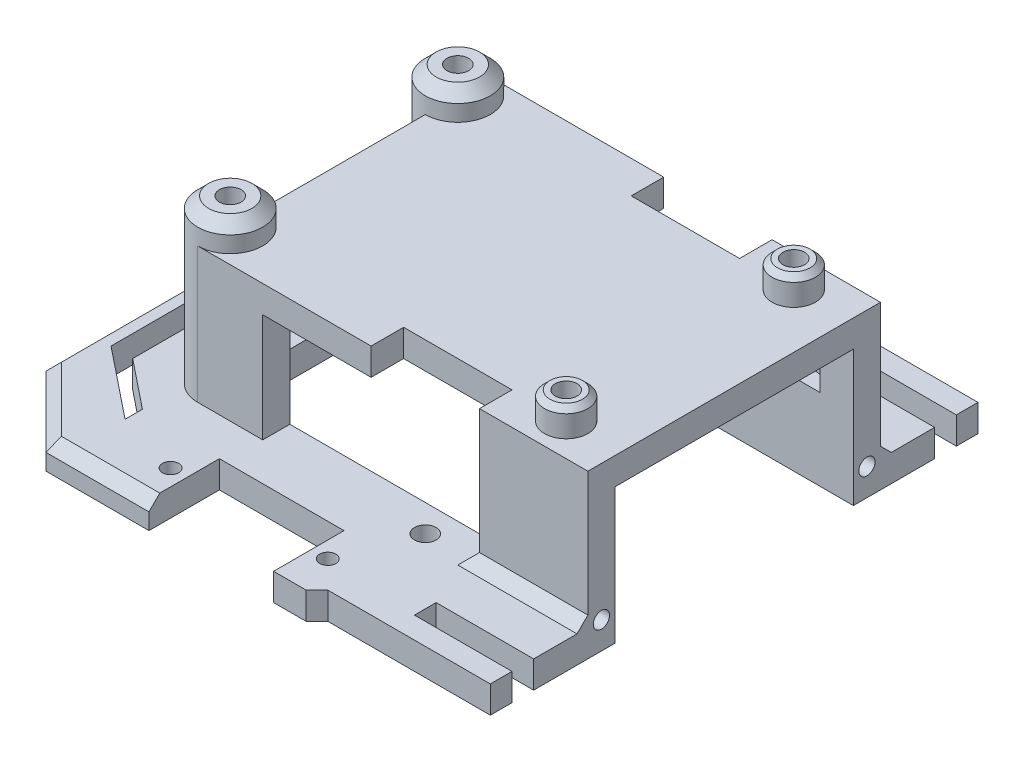
from build123d import *

# Parameters (mm, degrees)
SKETCH1_R           = 2
SKETCH1_R_2         = 1.5
BOSS_EXTRUDE1_DEPTH = 5
SKETCH2_W           = 4
SKETCH2_H           = 16
CUT_EXTRUDE1_DEPTH  = 5
BOSS_EXTRUDE3_DEPTH = 25
SKETCH4_W           = 72
SKETCH4_H           = 54
BOSS_EXTRUDE4_DEPTH = 5
SKETCH5_W           = 40
SKETCH5_H           = 20
CUT_EXTRUDE2_DEPTH  = 123.576506721
SKETCH6_W           = 20
SKETCH6_H           = 6
CUT_EXTRUDE4_DEPTH  = 10
BOSS_EXTRUDE5_START = -5
SKETCH7_R           = 4
BOSS_EXTRUDE5_DEPTH = 5
SKETCH8_R           = 2
CUT_EXTRUDE5_DEPTH  = 10
CUT_EXTRUDE6_START  = 10
SKETCH9_R           = 4
CUT_EXTRUDE6_DEPTH  = 10
BOSS_EXTRUDE6_START = 5
SKETCH10_R          = 6
BOSS_EXTRUDE6_DEPTH = 30
SKETCH11_R          = 2
CUT_EXTRUDE7_DEPTH  = 10
CUT_EXTRUDE8_START  = 20
SKETCH12_R          = 4.5
CUT_EXTRUDE8_DEPTH  = 129.434311913
SKETCH14_R          = 4.5
CUT_EXTRUDE11_DEPTH = 108.158760724
SKETCH13_R          = 1.5
BOSS_EXTRUDE8_DEPTH = 3
CHAMFER2_SIZE       = 1
CHAMFER3_SIZE       = 2
CHAMFER4_SIZE       = 2
CHAMFER5_SIZE       = 2
CUT_EXTRUDE15_START = -3
SKETCH13_3_R        = 1.5
CUT_EXTRUDE15_DEPTH = 3
CUT_EXTRUDE18_START = 3
SKETCH13_5_R        = 1.5
CUT_EXTRUDE18_DEPTH = 6
SKETCH23_R          = 1.5
CUT_EXTRUDE19_DEPTH = 6


with BuildPart() as part:
    # Sketch1 → Boss-Extrude1 (new body)
    with BuildSketch(Plane(origin=(0, 0, 0), x_dir=(1, 0, 0), z_dir=(0, 1, 0))):
        Polygon((0, 34), (0, -34), (13, -47), (32, -47), (32, -34), (55, -34), (55, -47), (61, -47), (63, -45), (93, -45), (93, -41), (75, -41), (75, -37), (93, -37), (93, -22), (33, -22), (21, -10), (21, 10), (33, 22), (93, 22), (93, 37), (75, 37), (75, 41), (93, 41), (93, 45), (63, 45), (61, 47), (55, 47), (55, 34), (32, 34), (32, 47), (13, 47), align=None)
        with Locations(Location((13, -10, 0), (0, 0, 270))):
            Circle(SKETCH1_R, mode=Mode.SUBTRACT)
        with Locations(Location((29, -40, 0), (0, 0, 270))):
            Circle(SKETCH1_R_2, mode=Mode.SUBTRACT)
        with Locations(Location((58, -40, 0), (0, 0, 270))):
            Circle(SKETCH1_R_2, mode=Mode.SUBTRACT)
        with Locations(Location((63, -27, 0), (0, 0, 270))):
            Circle(SKETCH1_R, mode=Mode.SUBTRACT)
        with Locations(Location((13, 10, 0), (0, 0, 90))):
            Circle(SKETCH1_R, mode=Mode.SUBTRACT)
        with Locations(Location((29, 40, 0), (0, 0, 90))):
            Circle(SKETCH1_R_2, mode=Mode.SUBTRACT)
        with Locations(Location((58, 40, 0), (0, 0, 90))):
            Circle(SKETCH1_R_2, mode=Mode.SUBTRACT)
        with Locations(Location((63, 27, 0), (0, 0, 90))):
            Circle(SKETCH1_R, mode=Mode.SUBTRACT)
    extrude(amount=BOSS_EXTRUDE1_DEPTH)

    # Sketch2 → Cut-Extrude1 (cut)
    with BuildSketch(Plane(origin=(0, 5, 0), x_dir=(1, 0, 0), z_dir=(0, 1, 0))):
        Polygon((17, 33.205766921), (17, 36.408329997), (4, 26), (4, 12), (8, 12), (8, 26), align=None)
        with Locations((6, 0)):
            Rectangle(SKETCH2_W, SKETCH2_H)
        Polygon((17, -33.205766921), (17, -36.408329997), (4, -26), (4, -12), (8, -12), (8, -26), align=None)
    extrude(amount=-CUT_EXTRUDE1_DEPTH, mode=Mode.SUBTRACT)

    # Sketch3 → Boss-Extrude3 (add)
    with BuildSketch(Plane(origin=(0, 5, 0), x_dir=(1, 0, 0), z_dir=(0, 1, 0))):
        Polygon((21, 27), (21, 10), (33, 22), (93, 22), (93, 27), align=None)
        Polygon((93, -27), (93, -22), (33, -22), (21, -10), (21, -27), align=None)
    extrude(amount=BOSS_EXTRUDE3_DEPTH)

    # Sketch4 → Boss-Extrude4 (add)
    with BuildSketch(Plane(origin=(0, 30, 0), x_dir=(1, 0, 0), z_dir=(0, 1, 0))):
        with Locations((57, 0)):
            Rectangle(SKETCH4_W, SKETCH4_H)
    extrude(amount=-BOSS_EXTRUDE4_DEPTH)

    # Sketch5 → Cut-Extrude2 (cut, through all)
    with BuildSketch(Plane.XY.offset(27)):
        with Locations((53, 15)):
            Rectangle(SKETCH5_W, SKETCH5_H)
    extrude(amount=-CUT_EXTRUDE2_DEPTH, mode=Mode.SUBTRACT)

    # Sketch6 → Cut-Extrude4 (cut)
    with BuildSketch(Plane(origin=(0, 30, 0), x_dir=(1, 0, 0), z_dir=(0, 1, 0))):
        with Locations((63, 24)):
            Rectangle(SKETCH6_W, SKETCH6_H)
        with Locations((63, -24)):
            Rectangle(SKETCH6_W, SKETCH6_H)
    extrude(amount=-CUT_EXTRUDE4_DEPTH, mode=Mode.SUBTRACT)

    # Sketch7 → Boss-Extrude5 (add)
    with BuildSketch(Plane.XZ.offset(-25).offset(BOSS_EXTRUDE5_START)):
        with Locations(Location((83, 21, 0), (0, 0, 270))):
            Circle(SKETCH7_R)
        with Locations(Location((83, -21, 0), (0, 0, 270))):
            Circle(SKETCH7_R)
    extrude(amount=-BOSS_EXTRUDE5_DEPTH)

    # Sketch8 → Cut-Extrude5 (cut)
    with BuildSketch(Plane(origin=(0, 35, 0), x_dir=(1, 0, 0), z_dir=(0, 1, 0))):
        with Locations(Location((83, 21, 0), (0, 0, 270))):
            Circle(SKETCH8_R)
    cut_extrude5 = extrude(amount=-CUT_EXTRUDE5_DEPTH, mode=Mode.SUBTRACT)

    # Sketch9 → Cut-Extrude6 (cut)
    with BuildSketch(Plane.XZ.offset(-25).offset(CUT_EXTRUDE6_START)):
        with Locations(Location((83, -21, 0), (0, 0, 270))):
            Circle(SKETCH9_R)
    cut_extrude6 = extrude(amount=-CUT_EXTRUDE6_DEPTH, mode=Mode.SUBTRACT)

    # Sketch10 → Boss-Extrude6 (add)
    with BuildSketch(Plane(origin=(0, 30, 0), x_dir=(1, 0, 0), z_dir=(0, 1, 0)).offset(BOSS_EXTRUDE6_START)):
        with Locations(Location((21, 21, 0), (0, 0, 270))):
            Circle(SKETCH10_R)
    boss_extrude6 = extrude(amount=-BOSS_EXTRUDE6_DEPTH)

    # Sketch11 → Cut-Extrude7 (cut)
    with BuildSketch(Plane(origin=(0, 35, 0), x_dir=(1, 0, 0), z_dir=(0, 1, 0))):
        with Locations(Location((21, 21, 0), (0, 0, 270))):
            Circle(SKETCH11_R)
    cut_extrude7 = extrude(amount=-CUT_EXTRUDE7_DEPTH, mode=Mode.SUBTRACT)

    # Sketch12 → Cut-Extrude8 (cut, through all)
    with BuildSketch(Plane(origin=(0, 5, 0), x_dir=(1, 0, 0), z_dir=(0, 1, 0)).offset(CUT_EXTRUDE8_START)):
        with Locations(Location((21, 21, 0), (0, 0, 270))):
            Circle(SKETCH12_R)
    extrude(amount=-CUT_EXTRUDE8_DEPTH, mode=Mode.SUBTRACT)

    # Mirror11: Cut-Extrude5, Cut-Extrude6 across plane
    add(cut_extrude5.mirror(Plane.XY), mode=Mode.SUBTRACT)
    add(cut_extrude6.mirror(Plane.XY), mode=Mode.SUBTRACT)

    # Mirror12: Boss-Extrude6 across plane
    add(boss_extrude6.mirror(Plane.XY))

    # Mirror16: Cut-Extrude7 across plane
    add(cut_extrude7.mirror(Plane.XY), mode=Mode.SUBTRACT)

    # Sketch14 → Cut-Extrude11 (cut, through all)
    with BuildSketch(Plane(origin=(0, 25, 0), x_dir=(1, 0, 0), z_dir=(0, 1, 0))):
        with Locations(Location((21, -21, 0), (0, 0, 270))):
            Circle(SKETCH14_R)
    extrude(amount=-CUT_EXTRUDE11_DEPTH, mode=Mode.SUBTRACT)

    # Sketch13 → Boss-Extrude8 (add)
    with BuildSketch(Plane(origin=(93, 0, 0), x_dir=(0, 0, -1), z_dir=(1, 0, 0))):
        with Locations(Location((24.5, 5, 0), (0, 0, 180))):
            Circle(SKETCH13_R)
    boss_extrude8 = extrude(amount=BOSS_EXTRUDE8_DEPTH)

    # Mirror19: Boss-Extrude8 across plane
    add(boss_extrude8.mirror(Plane.XY))

    # Chamfer2
    chamfer2_edges = [part.edges().sort_by_distance(p)[0] for p in [
        (83, 35, 25),
        (83, 35, -17),
    ]]
    chamfer(chamfer2_edges, length=CHAMFER2_SIZE)

    # Chamfer3
    chamfer3_edges = [part.edges().sort_by_distance(p)[0] for p in [
        (22.5, 5, -47),
        (6.5, 5, -40.5),
        (0, 5, 0),
        (6.5, 5, 40.5),
        (21, 35, -27),
        (21, 35, 27),
        (22.5, 5, 47),
    ]]
    chamfer(chamfer3_edges, length=CHAMFER3_SIZE)

    # Chamfer4
    chamfer4_edges = [part.edges().sort_by_distance(p)[0] for p in [
        (83, 5, -27),
        (83, 5, 27),
        (73, 5, 24.5),
        (73, 5, -24.5),
    ]]
    chamfer(chamfer4_edges, length=CHAMFER4_SIZE)

    # Chamfer5
    chamfer5_edges = [part.edges().sort_by_distance(p)[0] for p in [
        (83, 25, -23),
        (83, 25, 23),
    ]]
    chamfer(chamfer5_edges, length=CHAMFER5_SIZE - 0.0001)  # a hair under: the kernel refuses the full size

    # Sketch13<3> → Cut-Extrude15 (cut)
    with BuildSketch(Plane(origin=(93, 0, 0), x_dir=(0, 0, -1), z_dir=(1, 0, 0)).offset(CUT_EXTRUDE15_START)):
        with Locations((24.5, 5)):
            Circle(SKETCH13_3_R)
    extrude(amount=CUT_EXTRUDE15_DEPTH, mode=Mode.SUBTRACT)


with BuildPart() as cut_extrude15_piece_1:
    # of the separate pieces the step leaves, piece 1, a body of its own (cut_extrude15_pieces)
    add(part.part.solids().sort_by_distance((83, 25, -17.0001))[0])

    # Sketch23 → Cut-Extrude19 (cut)
    with BuildSketch(Plane(origin=(96, 0, 0), x_dir=(0, 0, -1), z_dir=(1, 0, 0))):
        with Locations((-24.5, 5)):
            Circle(SKETCH23_R)
    extrude(amount=-CUT_EXTRUDE19_DEPTH, mode=Mode.SUBTRACT)


with BuildPart() as cut_extrude15_piece_2:
    # of the separate pieces the step leaves, piece 2, a body of its own (cut_extrude15_pieces)
    add(part.part.solids().sort_by_distance((96, 5, -23))[0])

    # Sketch13<5> → Cut-Extrude18 (cut)
    with BuildSketch(Plane(origin=(93, 0, 0), x_dir=(0, 0, -1), z_dir=(1, 0, 0)).offset(CUT_EXTRUDE18_START)):
        with Locations((24.5, 5)):
            Circle(SKETCH13_5_R)
    extrude(amount=-CUT_EXTRUDE18_DEPTH, mode=Mode.SUBTRACT)


solid = cut_extrude15_piece_1.part
